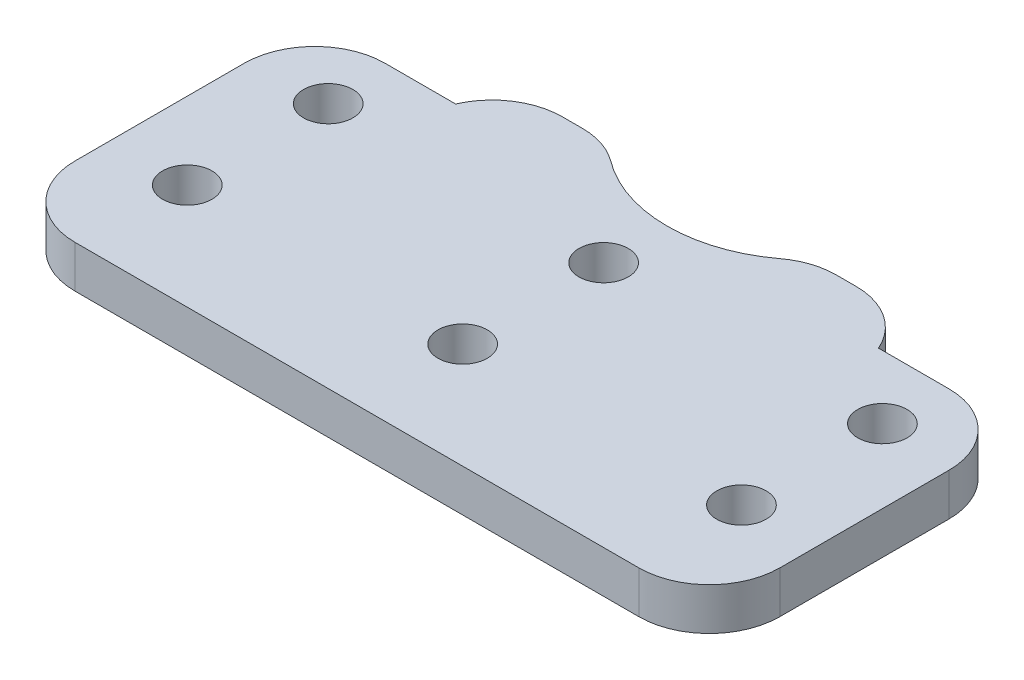
from build123d import *

# Parameters (mm, degrees)
SKETCH1_W           = 50
SKETCH1_H           = 25
SKETCH1_R           = 1.75
BOSS_EXTRUDE1_DEPTH = 3
SKETCH2_R           = 10
SKETCH2_W           = 10
SKETCH2_H           = 3
CUT_EXTRUDE1_DEPTH  = 10
FILLET1_R           = 5


with BuildPart() as part:
    # Sketch1 → Boss-Extrude1 (new body)
    with BuildSketch(Plane(origin=(0, 0, 0), x_dir=(1, 0, 0), z_dir=(0, 1, 0))):
        with Locations((25, 12.5)):
            Rectangle(SKETCH1_W, SKETCH1_H)
        with Locations(Location((25, 17.5, 0), (0, 0, 270))):
            Circle(SKETCH1_R, mode=Mode.SUBTRACT)
        with Locations(Location((25, 7.5, 0), (0, 0, 270))):
            Circle(SKETCH1_R, mode=Mode.SUBTRACT)
        with Locations(Location((5.463236706, 17.5, 0), (0, 0, 270))):
            Circle(SKETCH1_R, mode=Mode.SUBTRACT)
        with Locations(Location((5.463236706, 7.5, 0), (0, 0, 270))):
            Circle(SKETCH1_R, mode=Mode.SUBTRACT)
        with Locations(Location((44.777570027, 7.5, 0), (0, 0, 270))):
            Circle(SKETCH1_R, mode=Mode.SUBTRACT)
        with Locations(Location((44.777570027, 17.5, 0), (0, 0, 270))):
            Circle(SKETCH1_R, mode=Mode.SUBTRACT)
    extrude(amount=BOSS_EXTRUDE1_DEPTH)

    # Sketch2 → Cut-Extrude1 (cut)
    with BuildSketch(Plane(origin=(0, 3, 0), x_dir=(1, 0, 0), z_dir=(0, 1, 0))):
        with Locations((25, 32)):
            Circle(SKETCH2_R)
        with Locations((5, 23.5)):
            Rectangle(SKETCH2_W, SKETCH2_H)
        with Locations((45, 23.5)):
            Rectangle(SKETCH2_W, SKETCH2_H)
    extrude(amount=-CUT_EXTRUDE1_DEPTH, mode=Mode.SUBTRACT)

    # Fillet1
    # the kernel refuses this fillet: 5 mm, written as the material it takes off along each edge
    with BuildSketch(Plane(origin=(50, -12.5, 0), x_dir=(-1, 0, 0), z_dir=(0, 1, 0)), Plane(origin=(0, 15.5, -22), x_dir=(0, 0, 1), z_dir=(0, -1, 0))) as fillet1_piece_1:
        with BuildLine():
            CenterArc((FILLET1_R, -FILLET1_R), FILLET1_R, 90, 90)
            Line((0, -FILLET1_R), (-FILLET1_R * 0.02, -FILLET1_R))
            Line((-FILLET1_R * 0.02, -FILLET1_R), (-FILLET1_R * 0.02, FILLET1_R * 0.02))
            Line((-FILLET1_R * 0.02, FILLET1_R * 0.02), (FILLET1_R, FILLET1_R * 0.02))
            Line((FILLET1_R, FILLET1_R * 0.02), (FILLET1_R, 0))
        make_face()
    extrude(amount=28, mode=Mode.SUBTRACT)
    with BuildSketch(Plane(origin=(0, -12.5, 0), x_dir=(1, 0, 0), z_dir=(0, 1, 0)), Plane(origin=(50, 15.5, -22), x_dir=(0, 0, 1), z_dir=(0, -1, 0))) as fillet1_piece_2:
        with BuildLine():
            CenterArc((FILLET1_R, FILLET1_R), FILLET1_R, 180, 90)
            Line((0, FILLET1_R), (-FILLET1_R * 0.02, FILLET1_R))
            Line((-FILLET1_R * 0.02, FILLET1_R), (-FILLET1_R * 0.02, -FILLET1_R * 0.02))
            Line((-FILLET1_R * 0.02, -FILLET1_R * 0.02), (FILLET1_R, -FILLET1_R * 0.02))
            Line((FILLET1_R, -FILLET1_R * 0.02), (FILLET1_R, 0))
        make_face()
    extrude(amount=28, mode=Mode.SUBTRACT)
    with BuildSketch(Plane(origin=(40, 14.456439237, -25), x_dir=(-1, 0, 0), z_dir=(0, -1, 0))) as fillet1_piece_3:
        with BuildLine():
            CenterArc((4.582575695, -5), FILLET1_R, 90, 66.421821522)
            Line((0, -3), (-0.091651514, -2.96))
            ThreePointArc((-0.091651514, -2.96), (-0.1, -1.5), (-0.1, 0))
            Line((-0.1, 0), (0, 0.1))
            Line((0, 0.1), (4.582575695, 0.1))
            Line((4.582575695, 0.1), (4.582575695, 0))
        make_face()
    extrude(amount=25.912878475, mode=Mode.SUBTRACT)
    with BuildSketch(Plane(origin=(10, 14.456439237, -25), x_dir=(0, 0, 1), z_dir=(0, -1, 0))) as fillet1_piece_4:
        with BuildLine():
            CenterArc((5, -4.582575695), FILLET1_R, 113.578178478, 66.421821522)
            Line((0, -4.582575695), (-0.1, -4.582575695))
            Line((-0.1, -4.582575695), (-0.1, 0))
            Line((-0.1, 0), (0, 0.1))
            ThreePointArc((0, 0.1), (1.5, 0.1), (2.96, 0.091651514))
            Line((2.96, 0.091651514), (3, 0))
        make_face()
    extrude(amount=25.912878475, mode=Mode.SUBTRACT)
    with BuildSketch(Plane(origin=(17.858571571, -4.646428929, -25), x_dir=(-1, 0, 0), z_dir=(0, 1, 0))) as fillet1_piece_5:
        with BuildLine():
            CenterArc((1.858571571, 5), FILLET1_R, 233.130102354, 36.869897646)
            Line((-1.141428429, 1), (-1.201428429, 0.92))
            ThreePointArc((-1.201428429, 0.92), (-0.617614973, 0.446466141), (-0.071414284, -0.07))
            Line((-0.071414284, -0.07), (0, -0.1))
            Line((0, -0.1), (1.858571571, -0.1))
            Line((1.858571571, -0.1), (1.858571571, 0))
        make_face()
    extrude(amount=12.292857857, mode=Mode.SUBTRACT)
    with BuildSketch(Plane(origin=(32.141428429, -4.646428929, -25), x_dir=(-0.7521682970876359, 0, 0.658971056159742), z_dir=(0, 1, 0))) as fillet1_piece_6:
        with BuildLine():
            CenterArc((1.896896667, 4.985586357), FILLET1_R, 228.778553177, 36.869897646)
            Line((-1.397958614, 1.224744871), (-1.46385572, 1.149528042))
            Line((-1.46385572, 1.149528042), (-0.065897106, -0.07521683))
            Line((-0.065897106, -0.07521683), (0.007587587, -0.099711727))
            ThreePointArc((0.007587587, -0.099711727), (0.758758667, -0.071172714), (1.509929747, -0.099711727))
            Line((1.509929747, -0.099711727), (1.517517334, 0))
        make_face()
    extrude(amount=12.292857857, mode=Mode.SUBTRACT)


solid = part.part
